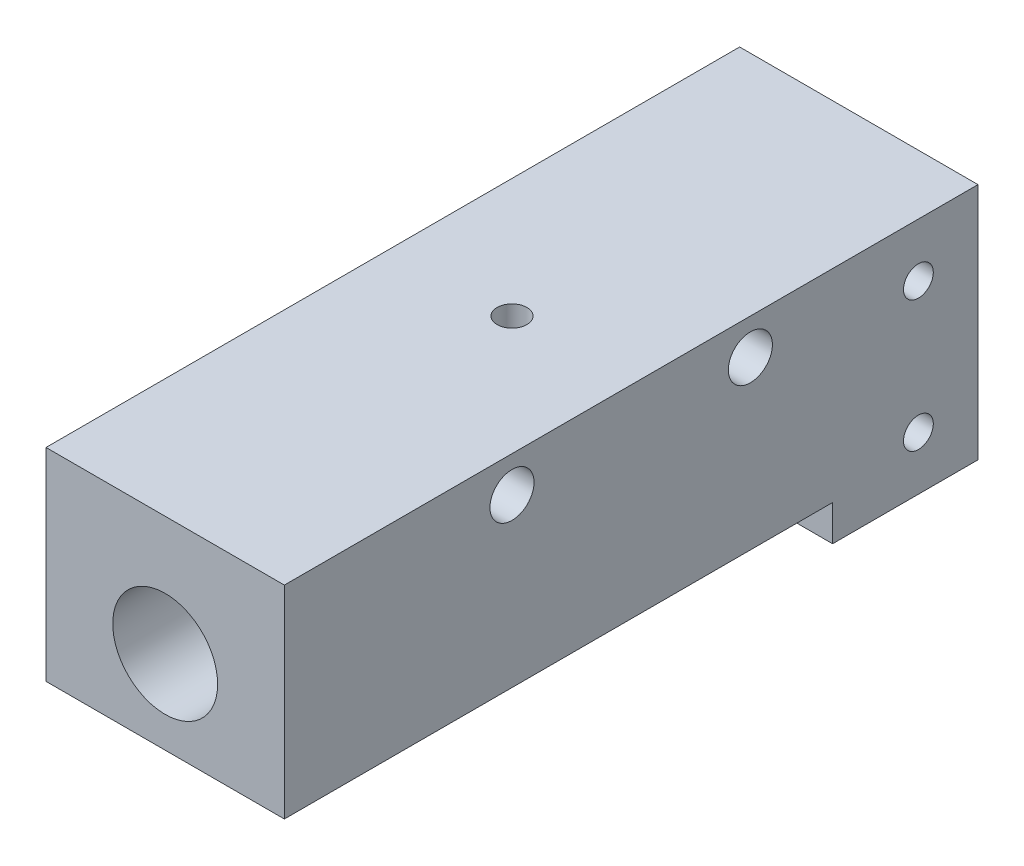
from build123d import *

# Parameters (mm, degrees)
SCHIZZO1_W                    = 20
SCHIZZO1_H                    = 20
ESTRUSIONE_ESTRUSIONE1_DEPTH  = 58.2
SCHIZZO2_R                    = 3
TAGLIO_ESTRUSIONE1_DEPTH      = 60.893572276
SCHIZZO4_R                    = 1.85
TAGLIO_ESTRUSIONE3_DEPTH      = 63.347734522
FORO_FILETTATO_G1_8_1_D       = 8.8
FORO_FILETTATO_G1_8_1_DEPTH   = 10
FORO_FILETTATO_G1_8_1_TIP     = 2.643786724
TAGLIO_ESTRUSIONE5_DEPTH      = 63.347734522
TAGLIO_ESTRUSIONE5_DEPTH_BACK = 63.347734522
FORO_FILETTATO_M3_1_D         = 2.5
FORO_FILETTATO_M3_1_DEPTH     = 5
FORO_FILETTATO_M3_1_TIP       = 0.751075774
FORO_FILETTATO_M3_2_D         = 2.5


with BuildPart() as part:
    # Schizzo1 → Estrusione-Estrusione1 (new body)
    with BuildSketch(Plane.XY):
        Rectangle(SCHIZZO1_W, SCHIZZO1_H)
    extrude(amount=-ESTRUSIONE_ESTRUSIONE1_DEPTH)

    # Schizzo2 → Taglio-Estrusione1 (cut, through all)
    with BuildSketch(Plane(origin=(0, 0, -58.2), x_dir=(-1, 0, 0), z_dir=(0, 0, -1))):
        Circle(SCHIZZO2_R)
    extrude(amount=-TAGLIO_ESTRUSIONE1_DEPTH, mode=Mode.SUBTRACT)

    # Schizzo4 → Taglio-Estrusione3 (cut, through all)
    with BuildSketch(Plane(origin=(10, 0, 0), x_dir=(0, 0, -1), z_dir=(1, 0, 0))):
        with Locations((19.1, 7)):
            Circle(SCHIZZO4_R)
        with Locations((39.1, 7)):
            Circle(SCHIZZO4_R)
    extrude(amount=-TAGLIO_ESTRUSIONE3_DEPTH, mode=Mode.SUBTRACT)

    # Foro filettato G1/8-1
    with Locations(Plane.XY):
        with Locations((0, 0)):
            Hole(FORO_FILETTATO_G1_8_1_D / 2, depth=FORO_FILETTATO_G1_8_1_DEPTH)
            with Locations((0, 0, -(FORO_FILETTATO_G1_8_1_DEPTH + FORO_FILETTATO_G1_8_1_TIP / 2))):  # 118° drill point
                Cone(0, FORO_FILETTATO_G1_8_1_D / 2, FORO_FILETTATO_G1_8_1_TIP, mode=Mode.SUBTRACT)

    # Schizzo10 → Taglio-Estrusione5 (cut, two sides: drawn at the far end of the back side and taken through both)
    with BuildSketch(Plane(origin=(10, 0, 0), x_dir=(0, 0, -1), z_dir=(1, 0, 0)).offset(-TAGLIO_ESTRUSIONE5_DEPTH_BACK)):
        Polygon((-131.2640095, -7), (0, -7), (46, -7), (46, -10), (46, -141.2640095), (-112.509379382, -350.53832089), (-289.773388882, -216.27431139), align=None)
    extrude(amount=TAGLIO_ESTRUSIONE5_DEPTH + TAGLIO_ESTRUSIONE5_DEPTH_BACK, mode=Mode.SUBTRACT)

    # Foro filettato M3-1
    with Locations(Plane(origin=(0, 10, -29.1), x_dir=(1, 0, 0), z_dir=(0, 1, 0))):
        with Locations((0, 0)):
            Hole(FORO_FILETTATO_M3_1_D / 2, depth=FORO_FILETTATO_M3_1_DEPTH)
            with Locations((0, 0, -(FORO_FILETTATO_M3_1_DEPTH + FORO_FILETTATO_M3_1_TIP / 2))):  # 118° drill point
                Cone(0, FORO_FILETTATO_M3_1_D / 2, FORO_FILETTATO_M3_1_TIP, mode=Mode.SUBTRACT)

    # Schizzo14 → Foro Ø16.0 (16)-1 (revolve, cut)
    with BuildSketch(Plane(origin=(0, 0, -58.2), x_dir=(0, 1, 0), z_dir=(1, 0, 0))):
        Polygon((0, 0), (0, 16.806884952), (8, 12), (8, 0), align=None)
    revolve(axis=Axis((0, 0, -64.55), (0, 0, 1)), mode=Mode.SUBTRACT)

    # Foro filettato M3-2 (through all)
    with Locations(Plane(origin=(10, 5.5, -53.2), x_dir=(0, 0, 1), z_dir=(1, 0, 0))):
        with Locations((0, 0), (0, 11)):
            Hole(FORO_FILETTATO_M3_2_D / 2)


solid = part.part
